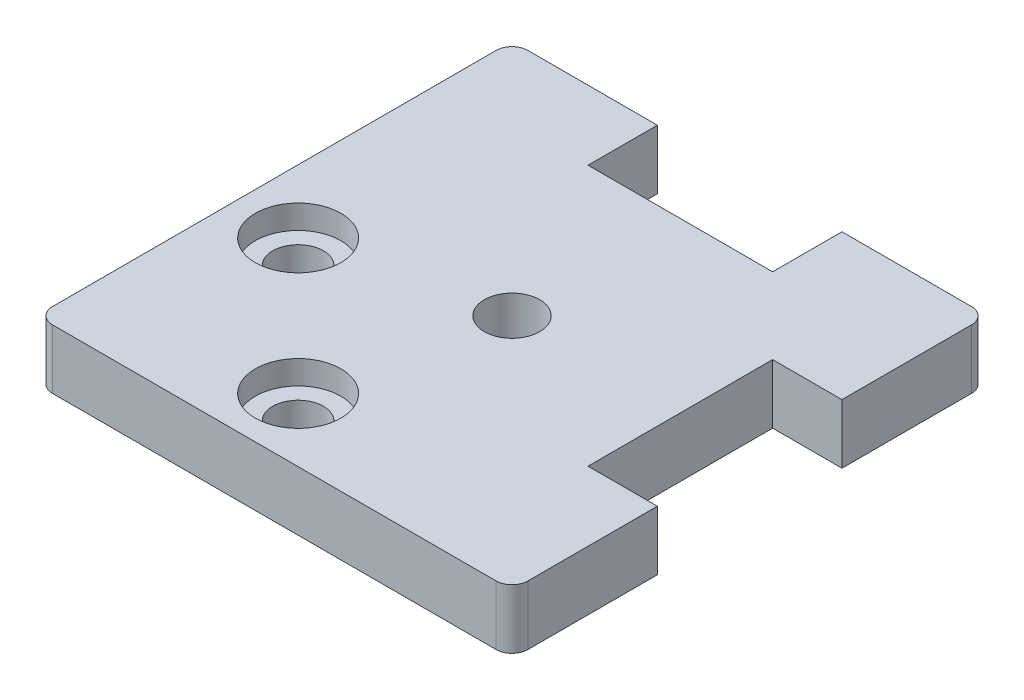
from build123d import *

# Parameters (mm, degrees)
SKETCH1_W                    = 76.2
SKETCH1_H                    = 76.2
BOSS_EXTRUDE1_DEPTH          = 9.525
SKETCH6_R                    = 3.81
CUT_EXTRUDE2_DEPTH           = 2.54
CUT_EXTRUDE2_DRAFT           = 30
CUT_EXTRUDE2_PROFILE_2_DEPTH = 2.54
CUT_EXTRUDE2_PROFILE_2_DRAFT = 30
CUT_EXTRUDE4_REACH           = 56.717
SKETCH12_R                   = 4.064
SKETCH13_R                   = 6.858
CUT_EXTRUDE7_DEPTH           = 3.81
SKETCH7_R                    = 4.445
CUT_EXTRUDE8_DEPTH           = 3.81
CUT_EXTRUDE8_TAPER           = 45
CUT_EXTRUDE9_REACH           = 56.717
SKETCH15_R                   = 4.445
FILLET1_R                    = 2.54
CUT_EXTRUDE10_REACH          = 56.717
SKETCH16_W                   = 29.591
SKETCH16_H                   = 11.1125
SKETCH16_W_2                 = 11.1125
SKETCH16_H_2                 = 29.591


with BuildPart() as part:
    # Sketch1 → Boss-Extrude1 (new body)
    with BuildSketch(Plane(origin=(0, 0, 0), x_dir=(1, 0, 0), z_dir=(0, 1, 0))):
        Rectangle(SKETCH1_W, SKETCH1_H)
    extrude(amount=BOSS_EXTRUDE1_DEPTH)


with BuildPart() as cut_extrude2_tool:
    # Sketch6 → Cut-Extrude2 (with draft: the straight prism first)
    with BuildSketch(Plane(origin=(0, 0, 0), x_dir=(1, 0, 0), z_dir=(0, 1, 0))):
        with Locations((-28.575, 28.575)):
            Circle(SKETCH6_R)
    extrude(amount=CUT_EXTRUDE2_DEPTH)
    # Cut-Extrude2: the draft: its side faces are tilted about the plane it starts from
    cut_extrude2_sides = [cut_extrude2_tool.faces().sort_by_distance(p)[0] for p in [
        (-32.385, 1.27, -28.575),
    ]]
    draft(cut_extrude2_sides, Plane(origin=(0, 0, 0), x_dir=(1, 0, 0), z_dir=(0, 1, 0)), CUT_EXTRUDE2_DRAFT)


with BuildPart() as part_1:
    add(part.part)

    # Cut-Extrude2: cut by cut_extrude2_tool
    add(cut_extrude2_tool.part, mode=Mode.SUBTRACT)


with BuildPart() as cut_extrude2_profile_2_tool:
    # Sketch6 → Cut-Extrude2 profile 2 (with draft: the straight prism first)
    with BuildSketch(Plane(origin=(0, 0, 0), x_dir=(1, 0, 0), z_dir=(0, 1, 0))):
        with Locations((28.575, -28.575)):
            Circle(SKETCH6_R)
    extrude(amount=CUT_EXTRUDE2_PROFILE_2_DEPTH)
    # Cut-Extrude2 profile 2: the draft: its side faces are tilted about the plane it starts from
    cut_extrude2_profile_2_sides = [cut_extrude2_profile_2_tool.faces().sort_by_distance(p)[0] for p in [
        (24.765, 1.27, 28.575),
    ]]
    draft(cut_extrude2_profile_2_sides, Plane(origin=(0, 0, 0), x_dir=(1, 0, 0), z_dir=(0, 1, 0)), CUT_EXTRUDE2_PROFILE_2_DRAFT)


with BuildPart() as part_2:
    add(part_1.part)

    # Cut-Extrude2 profile 2: cut by cut_extrude2_profile_2_tool
    add(cut_extrude2_profile_2_tool.part, mode=Mode.SUBTRACT)

    # Sketch12 → Cut-Extrude4 (cut, up to next)
    with BuildSketch(Plane(origin=(0, 9.525, 0), x_dir=(1, 0, 0), z_dir=(0, 1, 0)), mode=Mode.PRIVATE) as cut_extrude4_sk1:
        with Locations((-27.94, -6.35)):
            Circle(SKETCH12_R)
    cut_extrude4_tool1 = extrude(cut_extrude4_sk1.sketch, amount=-CUT_EXTRUDE4_REACH, mode=Mode.PRIVATE) & part_2.part
    # Sketch12 → Cut-Extrude4 (cut, up to next)
    with BuildSketch(Plane(origin=(0, 9.525, 0), x_dir=(1, 0, 0), z_dir=(0, 1, 0)), mode=Mode.PRIVATE) as cut_extrude4_sk2:
        with Locations((-6.35, -27.94)):
            Circle(SKETCH12_R)
    cut_extrude4_tool2 = extrude(cut_extrude4_sk2.sketch, amount=-CUT_EXTRUDE4_REACH, mode=Mode.PRIVATE) & part_2.part
    add(cut_extrude4_tool1.solids().sort_by_distance((-27.94, 9.525, 6.35))[0], mode=Mode.SUBTRACT)
    add(cut_extrude4_tool2.solids().sort_by_distance((-6.35, 9.525, 27.94))[0], mode=Mode.SUBTRACT)

    # Sketch13 → Cut-Extrude7 (cut)
    with BuildSketch(Plane.XZ.offset(-9.525)):
        with Locations((-27.94, 6.35)):
            Circle(SKETCH13_R)
        with Locations((-6.35, 27.94)):
            Circle(SKETCH13_R)
    extrude(amount=CUT_EXTRUDE7_DEPTH, mode=Mode.SUBTRACT)

    # Sketch7 → Cut-Extrude8 (cut)
    with BuildSketch(Plane(origin=(0, 0, 0), x_dir=(1, 0, 0), z_dir=(0, 1, 0))):
        with Locations((-27.94, -27.94)):
            Circle(SKETCH7_R)
    extrude(amount=CUT_EXTRUDE8_DEPTH, taper=CUT_EXTRUDE8_TAPER, mode=Mode.SUBTRACT)

    # Sketch15 → Cut-Extrude9 (cut, up to next)
    with BuildSketch(Plane(origin=(0, 9.525, 0), x_dir=(1, 0, 0), z_dir=(0, 1, 0)), mode=Mode.PRIVATE) as cut_extrude9_sk1:
        Circle(SKETCH15_R)
    cut_extrude9_tool1 = extrude(cut_extrude9_sk1.sketch, amount=-CUT_EXTRUDE9_REACH, mode=Mode.PRIVATE) & part_2.part
    add(cut_extrude9_tool1.solids().sort_by_distance((0, 9.525, 0))[0], mode=Mode.SUBTRACT)

    # Fillet1
    fillet1_edges = [part_2.edges().sort_by_distance(p)[0] for p in [
        (38.1, 4.7625, -38.1),
        (38.1, 4.7625, 38.1),
        (-38.1, 4.7625, 38.1),
        (-38.1, 4.7625, -38.1),
    ]]
    fillet(fillet1_edges, radius=FILLET1_R)

    # Sketch16 → Cut-Extrude10 (cut, up to next)
    with BuildSketch(Plane.XZ, mode=Mode.PRIVATE) as cut_extrude10_sk1:
        with Locations((0, -32.54375)):
            Rectangle(SKETCH16_W, SKETCH16_H)
    cut_extrude10_tool1 = extrude(cut_extrude10_sk1.sketch, amount=-CUT_EXTRUDE10_REACH, mode=Mode.PRIVATE) & part_2.part
    # Sketch16 → Cut-Extrude10 (cut, up to next)
    with BuildSketch(Plane.XZ, mode=Mode.PRIVATE) as cut_extrude10_sk2:
        with Locations((32.54375, 0)):
            Rectangle(SKETCH16_W_2, SKETCH16_H_2)
    cut_extrude10_tool2 = extrude(cut_extrude10_sk2.sketch, amount=-CUT_EXTRUDE10_REACH, mode=Mode.PRIVATE) & part_2.part
    add(cut_extrude10_tool1.solids().sort_by_distance((0, 0, -32.54375))[0], mode=Mode.SUBTRACT)
    add(cut_extrude10_tool2.solids().sort_by_distance((32.54375, 0, 0))[0], mode=Mode.SUBTRACT)


solid = part_2.part
